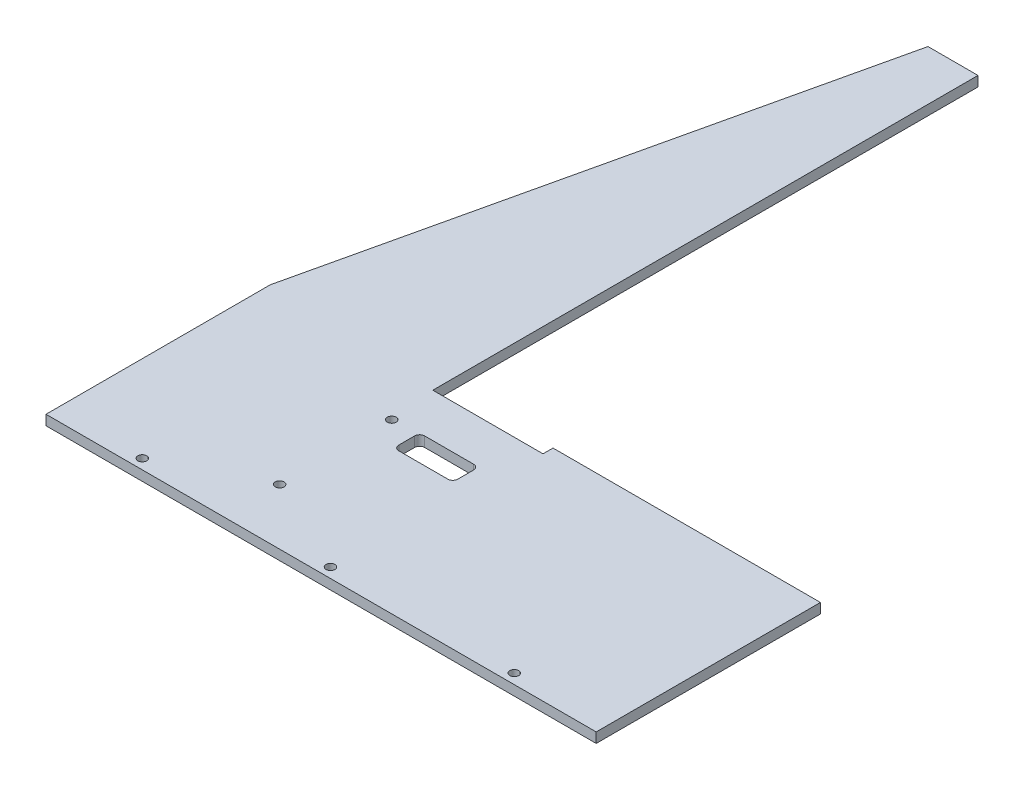
from build123d import *

# Parameters (mm, degrees)
LEG_START     = -10.839044341
LEG_OUTLINE_R = 2.65
LEG_DEPTH     = 6


# Read off the part's stored shape, not the designer's step: leg
with BuildPart() as part:
    # leg outline → leg (new body)
    with BuildSketch(Plane(origin=(0, 0, 0), x_dir=(1, 0, 0), z_dir=(0, 1, 0)).offset(LEG_START)):
        Polygon((-105.386140363, -62.9747167), (224.613859637, -62.9747167), (224.613859637, 71.5252833), (64.213859637, 71.5252833), (64.213859637, 65.5252833), (-1.886140363, 65.5252833), (-1.886140363, 392.5252833), (-31.886140363, 392.5252833), (-105.386140363, 71.5252833), align=None)
        with Locations((-53.636140363, -56.9747167)):
            Circle(LEG_OUTLINE_R, mode=Mode.SUBTRACT)
        with Locations((1.113859637, -29.3497167)):
            Circle(LEG_OUTLINE_R, mode=Mode.SUBTRACT)
        with Locations((59.238859637, -56.9747167)):
            Circle(LEG_OUTLINE_R, mode=Mode.SUBTRACT)
        with Locations((1.113859637, 37.9002833)):
            Circle(LEG_OUTLINE_R, mode=Mode.SUBTRACT)
        with BuildLine():
            Line((16.413859637, 26.8252833), (16.413859637, 36.3252833))
            ThreePointArc((16.413859637, 36.3252833), (17.292539294, 38.446603644), (19.413859637, 39.3252833))
            Line((19.413859637, 39.3252833), (48.813859637, 39.3252833))
            ThreePointArc((48.813859637, 39.3252833), (50.935179981, 38.446603644), (51.813859637, 36.3252833))
            Line((51.813859637, 36.3252833), (51.813859637, 26.8252833))
            ThreePointArc((51.813859637, 26.8252833), (50.93517998, 24.703962956), (48.813859637, 23.8252833))
            Line((48.813859637, 23.8252833), (19.413859637, 23.8252833))
            ThreePointArc((19.413859637, 23.8252833), (17.292539294, 24.703962957), (16.413859637, 26.8252833))
        make_face(mode=Mode.SUBTRACT)
        with Locations((169.488859637, -56.9747167)):
            Circle(LEG_OUTLINE_R, mode=Mode.SUBTRACT)
    extrude(amount=LEG_DEPTH)


solid = part.part
